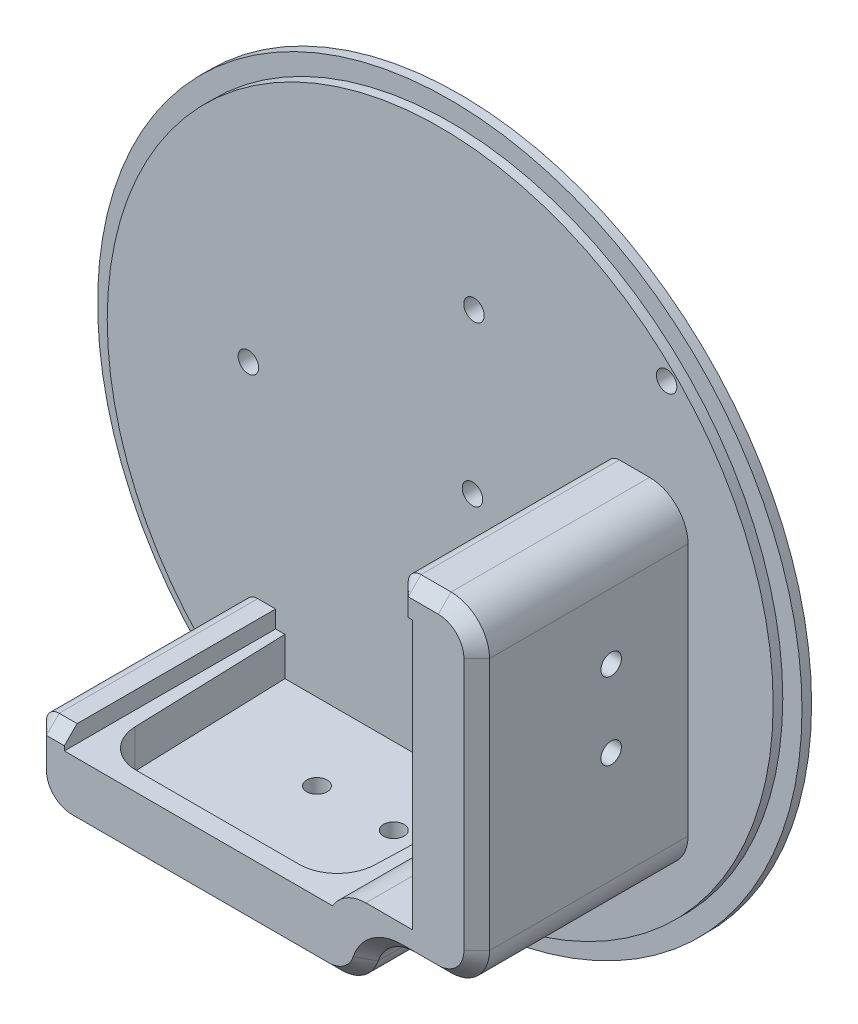
from build123d import *

# Parameters (mm, degrees)
SKIZZE1_R                        = 52
AUFSATZ_LINEAR_AUSTRAGEN1_DEPTH  = 3
SKIZZE1_3_R                      = 55
SKIZZE1_3_R_2                    = 52
AUFSATZ_LINEAR_AUSTRAGEN2_DEPTH  = 1.5
SCHNITT_LINEAR_AUSTRAGEN1_REACH  = 79.84
SKIZZE3_R                        = 1.6
AUFSATZ_LINEAR_AUSTRAGEN3_DEPTH  = 33
SCHNITT_LINEAR_AUSTRAGEN4_REACH  = 120.458
SCHNITT_LINEAR_START             = -4
VERRUNDUNG1_R                    = 6
SCHNITT_LINEAR_AUSTRAGEN9_DEPTH  = 6
VERRUNDUNG2_R                    = 6
VERRUNDUNG4_R                    = 6
VERRUNDUNG5_R                    = 6
VERRUNDUNG6_R                    = 2
SCHNITT_LINEAR_AUSTRAGEN10_REACH = 116.458
SKIZZE8_R                        = 1.6
SCHNITT_LINEAR_AUSTRAGEN11_REACH = 116.458
SKIZZE9_R                        = 1.6
VERRUNDUNG7_R                    = 6
SCHNITT_LINEAR_AUSTRAGEN13_REACH = 87.709
SKIZZE10_R                       = 1.6
FASE1_SIZE                       = 2


# Some blends are built 0.0001 mm under size
with BuildPart() as part:
    # Skizze1 → Aufsatz-Linear austragen1 (new body)
    with BuildSketch(Plane.XY):
        Circle(SKIZZE1_R)
    extrude(amount=AUFSATZ_LINEAR_AUSTRAGEN1_DEPTH)

    # Skizze1<3> → Aufsatz-Linear austragen2 (add)
    with BuildSketch(Plane.XY):
        Circle(SKIZZE1_3_R)
        Circle(SKIZZE1_3_R_2, mode=Mode.SUBTRACT)
    extrude(amount=AUFSATZ_LINEAR_AUSTRAGEN2_DEPTH)

    # Skizze3 → Schnitt-Linear austragen1 (cut, up to next)
    with BuildSketch(Plane.XY.offset(3), mode=Mode.PRIVATE) as schnitt_linear_austragen1_sk1:
        with Locations((5.041583425, 4.948905083)):
            Circle(SKIZZE3_R)
    schnitt_linear_austragen1_tool1 = extrude(schnitt_linear_austragen1_sk1.sketch, amount=-SCHNITT_LINEAR_AUSTRAGEN1_REACH, mode=Mode.PRIVATE) & part.part
    # Skizze3 → Schnitt-Linear austragen1 (cut, up to next)
    with BuildSketch(Plane.XY.offset(3), mode=Mode.PRIVATE) as schnitt_linear_austragen1_sk2:
        with Locations((5.275786867, 29.947808034)):
            Circle(SKIZZE3_R)
    schnitt_linear_austragen1_tool2 = extrude(schnitt_linear_austragen1_sk2.sketch, amount=-SCHNITT_LINEAR_AUSTRAGEN1_REACH, mode=Mode.PRIVATE) & part.part
    # Skizze3 → Schnitt-Linear austragen1 (cut, up to next)
    with BuildSketch(Plane.XY.offset(3), mode=Mode.PRIVATE) as schnitt_linear_austragen1_sk3:
        with Locations((-29.956880706, 5.276789902)):
            Circle(SKIZZE3_R)
    schnitt_linear_austragen1_tool3 = extrude(schnitt_linear_austragen1_sk3.sketch, amount=-SCHNITT_LINEAR_AUSTRAGEN1_REACH, mode=Mode.PRIVATE) & part.part
    add(schnitt_linear_austragen1_tool1.solids().sort_by_distance((5.041583, 4.948905, 3))[0], mode=Mode.SUBTRACT)
    add(schnitt_linear_austragen1_tool2.solids().sort_by_distance((5.275787, 29.947808, 3))[0], mode=Mode.SUBTRACT)
    add(schnitt_linear_austragen1_tool3.solids().sort_by_distance((-29.956881, 5.27679, 3))[0], mode=Mode.SUBTRACT)

    # Skizze2 → Aufsatz-Linear austragen3 (add)
    with BuildSketch(Plane.XY.offset(3)):
        Polygon((26, 21), (26, 16.2), (27.2, 16.2), (28.7, 16.2), (28.7, 15), (28.7, -24.5), (28.7, -25.7), (27.2, -25.7), (26, -25.7), (16.2, -25.7), (16.2, -26), (16.2, -27.2), (16.2, -28.7), (15, -28.7), (-24.5, -28.7), (-25.7, -28.7), (-25.7, -27.2), (-25.7, -26), (-30.5, -26), (-30.5, -33.3), (-30.5, -38.7), (-24.5, -38.7), (15, -38.7), (21, -38.7), (21, -33.3), (21, -30.5), (26, -30.5), (33.3, -30.5), (38.7, -30.5), (38.7, -24.5), (38.7, 15), (38.7, 21), (33.3, 21), align=None)
    extrude(amount=AUFSATZ_LINEAR_AUSTRAGEN3_DEPTH)

    # Skizze6 → Schnitt-Linear austragen4 (cut, up to next)
    with BuildSketch(Plane.XZ.offset(38.7).offset(SCHNITT_LINEAR_START), mode=Mode.PRIVATE) as schnitt_linear_austragen4_sk1:
        Polygon((-24.25, 3), (-23.25, 33), (13.75, 33), (14.75, 3), align=None)
    schnitt_linear_austragen4_tool1 = extrude(schnitt_linear_austragen4_sk1.sketch, amount=-SCHNITT_LINEAR_AUSTRAGEN4_REACH, mode=Mode.PRIVATE) & part.part
    add(schnitt_linear_austragen4_tool1.solids().sort_by_distance((-4.75, -34.7, 17.868421))[0], mode=Mode.SUBTRACT)

    # Verrundung1
    verrundung1_edges = [part.edges().sort_by_distance(p)[0] for p in [
        (-23.25, -31.7, 33),
        (13.75, -31.7, 33),
    ]]
    fillet(verrundung1_edges, radius=VERRUNDUNG1_R)

    # Skizze7 → Schnitt-Linear austragen9 (cut)
    with BuildSketch(Plane.ZY.offset(-28.7)):
        Polygon((33, -23.25), (33, 13.75), (3, 14.75), (3, -24.25), align=None)
    extrude(amount=-SCHNITT_LINEAR_AUSTRAGEN9_DEPTH, mode=Mode.SUBTRACT)

    # Verrundung2
    verrundung2_edges = [part.edges().sort_by_distance(p)[0] for p in [
        (31.7, -23.25, 33),
        (31.7, 13.75, 33),
    ]]
    fillet(verrundung2_edges, radius=VERRUNDUNG2_R)

    # Verrundung4
    verrundung4_edges = [part.edges().sort_by_distance(p)[0] for p in [
        (21, -30.5, 19.5),
    ]]
    fillet(verrundung4_edges, radius=VERRUNDUNG4_R)

    # Verrundung5
    # the kernel refuses this fillet: 6 mm, written as the material it takes off along each edge
    with BuildSketch(Plane(origin=(16.2, -25.7, 3), x_dir=(1, 0, 0), z_dir=(0, 0, 1))) as verrundung5_piece_1:
        with BuildLine():
            CenterArc((5.196152423, -6), VERRUNDUNG5_R, 90, 60)
            Line((0, -3), (0, 0))
            Line((0, 0), (5.196152423, 0))
        make_face()
    extrude(amount=45.990381057, mode=Mode.SUBTRACT)

    # Verrundung6
    verrundung6_edges = [part.edges().sort_by_distance(p)[0] for p in [
        (26, 21, 19.5),
        (-30.5, -26, 19.5),
    ]]
    fillet(verrundung6_edges, radius=VERRUNDUNG6_R)

    # Skizze8 → Schnitt-Linear austragen10 (cut, up to next)
    with BuildSketch(Plane.XZ.offset(38.7), mode=Mode.PRIVATE) as schnitt_linear_austragen10_sk1:
        with Locations(Location((4.75, 15, 0), (0, 0, 270))):
            Circle(SKIZZE8_R)
    schnitt_linear_austragen10_tool1 = extrude(schnitt_linear_austragen10_sk1.sketch, amount=-SCHNITT_LINEAR_AUSTRAGEN10_REACH, mode=Mode.PRIVATE) & part.part
    # Skizze8 → Schnitt-Linear austragen10 (cut, up to next)
    with BuildSketch(Plane.XZ.offset(38.7), mode=Mode.PRIVATE) as schnitt_linear_austragen10_sk2:
        with Locations(Location((-7.25, 15, 0), (0, 0, 270))):
            Circle(SKIZZE8_R)
    schnitt_linear_austragen10_tool2 = extrude(schnitt_linear_austragen10_sk2.sketch, amount=-SCHNITT_LINEAR_AUSTRAGEN10_REACH, mode=Mode.PRIVATE) & part.part
    add(schnitt_linear_austragen10_tool1.solids().sort_by_distance((4.75, -38.7, 15))[0], mode=Mode.SUBTRACT)
    add(schnitt_linear_austragen10_tool2.solids().sort_by_distance((-7.25, -38.7, 15))[0], mode=Mode.SUBTRACT)

    # Skizze9 → Schnitt-Linear austragen11 (cut, up to next)
    with BuildSketch(Plane(origin=(38.7, 0, 0), x_dir=(0, 0, -1), z_dir=(1, 0, 0)), mode=Mode.PRIVATE) as schnitt_linear_austragen11_sk1:
        with Locations((-15, -7.25)):
            Circle(SKIZZE9_R)
    schnitt_linear_austragen11_tool1 = extrude(schnitt_linear_austragen11_sk1.sketch, amount=-SCHNITT_LINEAR_AUSTRAGEN11_REACH, mode=Mode.PRIVATE) & part.part
    # Skizze9 → Schnitt-Linear austragen11 (cut, up to next)
    with BuildSketch(Plane(origin=(38.7, 0, 0), x_dir=(0, 0, -1), z_dir=(1, 0, 0)), mode=Mode.PRIVATE) as schnitt_linear_austragen11_sk2:
        with Locations((-15, 4.75)):
            Circle(SKIZZE9_R)
    schnitt_linear_austragen11_tool2 = extrude(schnitt_linear_austragen11_sk2.sketch, amount=-SCHNITT_LINEAR_AUSTRAGEN11_REACH, mode=Mode.PRIVATE) & part.part
    add(schnitt_linear_austragen11_tool1.solids().sort_by_distance((38.7, -7.25, 15))[0], mode=Mode.SUBTRACT)
    add(schnitt_linear_austragen11_tool2.solids().sort_by_distance((38.7, 4.75, 15))[0], mode=Mode.SUBTRACT)

    # Verrundung7
    verrundung7_edges = [part.edges().sort_by_distance(p)[0] for p in [
        (38.7, 21, 19.5),
        (-30.5, -38.7, 19.5),
        (21, -38.7, 19.5),
        (38.7, -30.5, 19.5),
    ]]
    fillet(verrundung7_edges, radius=VERRUNDUNG7_R)

    # Skizze10 → Schnitt-Linear austragen13 (cut, up to next)
    with BuildSketch(Plane(origin=(0, 0, 0), x_dir=(-1, 0, 0), z_dir=(0, 0, -1)), mode=Mode.PRIVATE) as schnitt_linear_austragen13_sk1:
        with Locations((35.355339059, -35.355339059)):
            Circle(SKIZZE10_R)
    schnitt_linear_austragen13_tool1 = extrude(schnitt_linear_austragen13_sk1.sketch, amount=-SCHNITT_LINEAR_AUSTRAGEN13_REACH, mode=Mode.PRIVATE) & part.part
    # Skizze10 → Schnitt-Linear austragen13 (cut, up to next)
    with BuildSketch(Plane(origin=(0, 0, 0), x_dir=(-1, 0, 0), z_dir=(0, 0, -1)), mode=Mode.PRIVATE) as schnitt_linear_austragen13_sk2:
        with Locations((-35.355339059, 35.355339059)):
            Circle(SKIZZE10_R)
    schnitt_linear_austragen13_tool2 = extrude(schnitt_linear_austragen13_sk2.sketch, amount=-SCHNITT_LINEAR_AUSTRAGEN13_REACH, mode=Mode.PRIVATE) & part.part
    add(schnitt_linear_austragen13_tool1.solids().sort_by_distance((-35.355339, -35.355339, 0))[0], mode=Mode.SUBTRACT)
    add(schnitt_linear_austragen13_tool2.solids().sort_by_distance((35.355339, 35.355339, 0))[0], mode=Mode.SUBTRACT)

    # Fase1
    fase1_edges = [part.edges().sort_by_distance(p)[0] for p in [
        (-30.5, -30.35, 36),
        (26, 17.6, 36),
        (26.585786438, 20.414213562, 36),
        (-29.914213562, -26.585786438, 36),
        (30.35, 21, 36),
        (38.7, -4.75, 36),
        (-4.44122131, -38.7, 36),
        (23.492864417, -31.631735422, 36),
        (29.85, -30.5, 36),
        (36.942640687, -28.742640687, 36),
        (19.124692969, -37.568264574, 36),
        (-28.742640687, -36.942640687, 36),
        (36.942640687, 19.242640687, 36),
        (-27.1, -26, 36),
    ]]
    chamfer(fase1_edges, length=FASE1_SIZE - 0.0001)  # a hair under: the kernel refuses the full size


solid = part.part
